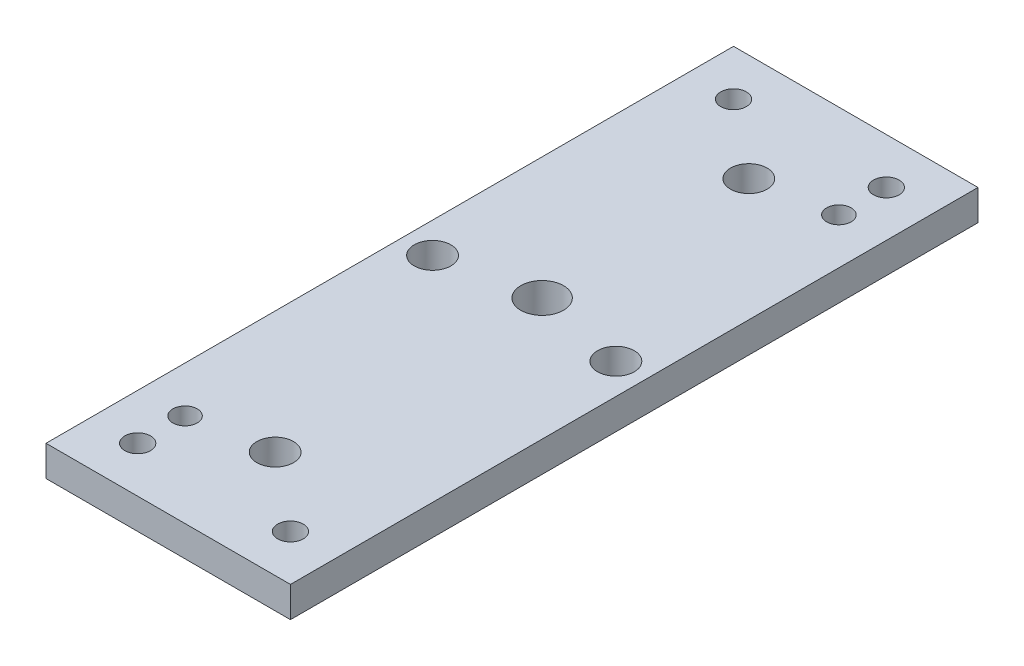
from build123d import *

# Parameters (mm, degrees)
SKETCH1_W             = 80
SKETCH1_H             = 225
BOSS_EXTRUDE1_DEPTH   = 10
CUT_EXTRUDE1_REACH    = 121.818
SKETCH2_R             = 6
M8_CLEARANCE_HOLE1_D  = 8.4
F_8_0MM_DOWEL_HOLE1_D = 8
CUT_EXTRUDE3_REACH    = 121.818
SKETCH10_R            = 7


with BuildPart() as part:
    # Sketch1 → Boss-Extrude1 (new body)
    with BuildSketch(Plane(origin=(0, 0, 0), x_dir=(1, 0, 0), z_dir=(0, 1, 0))):
        Rectangle(SKETCH1_W, SKETCH1_H)
    extrude(amount=-BOSS_EXTRUDE1_DEPTH)

    # Sketch2 → Cut-Extrude1 (cut, up to next)
    with BuildSketch(Plane(origin=(0, 0, 0), x_dir=(1, 0, 0), z_dir=(0, 1, 0)), mode=Mode.PRIVATE) as cut_extrude1_sk1:
        with Locations((0, 77.5)):
            Circle(SKETCH2_R)
    cut_extrude1_tool1 = extrude(cut_extrude1_sk1.sketch, amount=-CUT_EXTRUDE1_REACH, mode=Mode.PRIVATE) & part.part
    # Sketch2 → Cut-Extrude1 (cut, up to next)
    with BuildSketch(Plane(origin=(0, 0, 0), x_dir=(1, 0, 0), z_dir=(0, 1, 0)), mode=Mode.PRIVATE) as cut_extrude1_sk2:
        with Locations((30, 4)):
            Circle(SKETCH2_R)
    cut_extrude1_tool2 = extrude(cut_extrude1_sk2.sketch, amount=-CUT_EXTRUDE1_REACH, mode=Mode.PRIVATE) & part.part
    # Sketch2 → Cut-Extrude1 (cut, up to next)
    with BuildSketch(Plane(origin=(0, 0, 0), x_dir=(1, 0, 0), z_dir=(0, 1, 0)), mode=Mode.PRIVATE) as cut_extrude1_sk3:
        with Locations((-30, 4)):
            Circle(SKETCH2_R)
    cut_extrude1_tool3 = extrude(cut_extrude1_sk3.sketch, amount=-CUT_EXTRUDE1_REACH, mode=Mode.PRIVATE) & part.part
    # Sketch2 → Cut-Extrude1 (cut, up to next)
    with BuildSketch(Plane(origin=(0, 0, 0), x_dir=(1, 0, 0), z_dir=(0, 1, 0)), mode=Mode.PRIVATE) as cut_extrude1_sk4:
        with Locations((0, -77.5)):
            Circle(SKETCH2_R)
    cut_extrude1_tool4 = extrude(cut_extrude1_sk4.sketch, amount=-CUT_EXTRUDE1_REACH, mode=Mode.PRIVATE) & part.part
    add(cut_extrude1_tool1.solids().sort_by_distance((0, 0, -77.5))[0], mode=Mode.SUBTRACT)
    add(cut_extrude1_tool2.solids().sort_by_distance((30, 0, -4))[0], mode=Mode.SUBTRACT)
    add(cut_extrude1_tool3.solids().sort_by_distance((-30, 0, -4))[0], mode=Mode.SUBTRACT)
    add(cut_extrude1_tool4.solids().sort_by_distance((0, 0, 77.5))[0], mode=Mode.SUBTRACT)

    # M8 Clearance Hole1 (through all)
    with Locations(Plane(origin=(0, 0, 0), x_dir=(1, 0, 0), z_dir=(0, 1, 0))):
        with Locations((-25, 97.5), (25, 97.5), (25, -97.5), (-25, -97.5)):
            Hole(M8_CLEARANCE_HOLE1_D / 2)

    # Ø8.0mm Dowel Hole1 (through all)
    with Locations(Plane(origin=(0, 0, 0), x_dir=(1, 0, 0), z_dir=(0, 1, 0))):
        with Locations((25, 81.975), (-25, -82)):
            Hole(F_8_0MM_DOWEL_HOLE1_D / 2)

    # Sketch10 → Cut-Extrude3 (cut, up to next)
    with BuildSketch(Plane(origin=(0, 0, 0), x_dir=(1, 0, 0), z_dir=(0, 1, 0)), mode=Mode.PRIVATE) as cut_extrude3_sk1:
        with Locations((0, 9.86)):
            Circle(SKETCH10_R)
    cut_extrude3_tool1 = extrude(cut_extrude3_sk1.sketch, amount=-CUT_EXTRUDE3_REACH, mode=Mode.PRIVATE) & part.part
    add(cut_extrude3_tool1.solids().sort_by_distance((0, 0, -9.86))[0], mode=Mode.SUBTRACT)


solid = part.part
